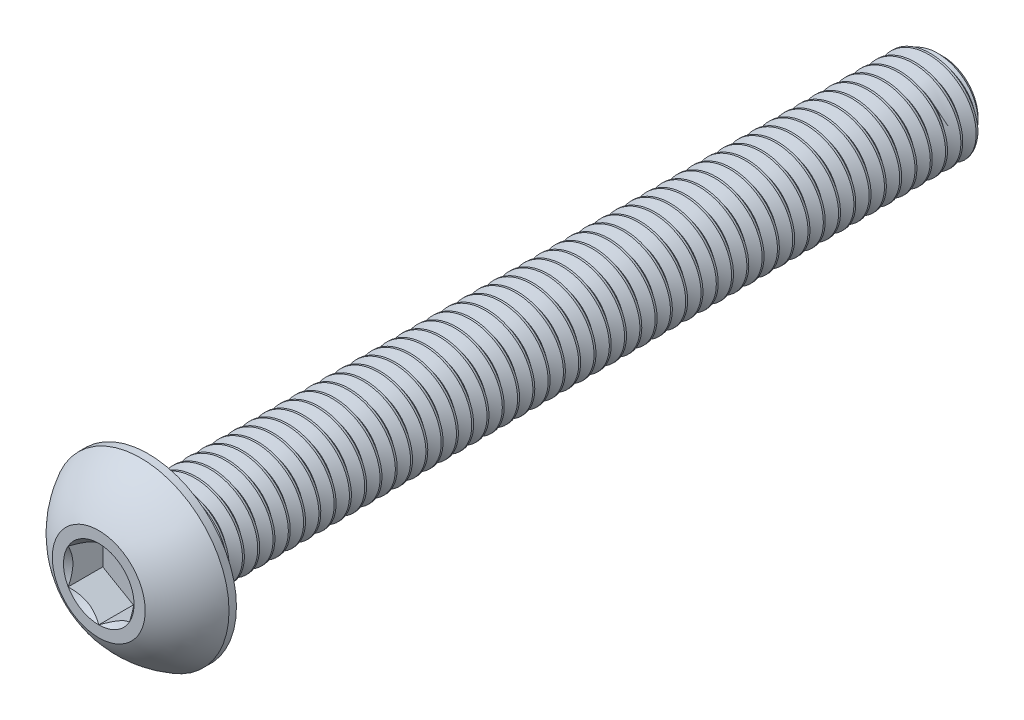
from build123d import *

# Parameters (mm, degrees)
SKETCH1_W          = 41.275
SKETCH1_H          = 2.413
CHAMFER1_SIZE      = 0.5953125
CUT_SWEEP1_PITCH   = 0.79375
CUT_EXTRUDE2_DEPTH = 1.79578
SKETCH6_R          = 1.833087105
CUT_EXTRUDE3_DEPTH = 1.79578
CUT_EXTRUDE3_TAPER = 45


with BuildPart() as part:
    # Sketch1 → Revolve1 (revolve)
    with BuildSketch(Plane(origin=(0, 0, 0), x_dir=(0, 0, -1), z_dir=(1, 0, 0))):
        with Locations((23.2029, 1.2065)):
            Rectangle(SKETCH1_W, SKETCH1_H)
    revolve(axis=Axis((0, 0, -43.8404), (0, 0, 1)))

    # Chamfer1
    chamfer1_edges = [part.edges().sort_by_distance(p)[0] for p in [
        (0, -2.413, -43.8404),
    ]]
    chamfer(chamfer1_edges, length=CHAMFER1_SIZE)

    # Cut-Sweep1: arcs per turn and ends read off the stored shape
    # Cut-Sweep1: the profile of Sketch2 profile screwed along a right-hand helix through 53 turns, 6 arcs to a turn; built about Z, then put on its axis
    cut_sweep1_z = Axis((0, 0, 0), (0, 0, 1))
    cut_sweep1_corners = [(2.4133, 0, 0.000173205), (2.4133, 0, -0.694704455), (1.897444252, 0, -0.396875), (1.897444252, 0, -0.29765625)]
    with BuildLine(mode=Mode.PRIVATE) as cut_sweep1_profile:
        Line(cut_sweep1_corners[0], cut_sweep1_corners[1])
        Line(cut_sweep1_corners[1], cut_sweep1_corners[2])
        Line(cut_sweep1_corners[2], cut_sweep1_corners[3])
        Line(cut_sweep1_corners[3], cut_sweep1_corners[0])
    cut_sweep1_cap = Face(cut_sweep1_profile.wire())
    cut_sweep1_turn_angles = [0, 30, 60, 90, 120, 150, 180, 210, 240, 270, 300, 330, 360]
    cut_sweep1_turn_weights = [1, 0.8660254037844387, 1, 0.8660254037844387, 1, 0.8660254037844387, 1, 0.8660254037844387, 1, 0.8660254037844387, 1, 0.8660254037844387, 1]
    cut_sweep1_turn_rails = [Edge.make_bspline([Vector(p[0], p[1], 0).rotate(cut_sweep1_z, cut_sweep1_turn_angles[k]) / cut_sweep1_turn_weights[k] + Vector(0, 0, p[2] + CUT_SWEEP1_PITCH * cut_sweep1_turn_angles[k] / 360) for k in range(13)], [0, 0, 0, 1, 1, 2, 2, 3, 3, 4, 4, 5, 5, 6, 6, 6], 2, cut_sweep1_turn_weights) for p in cut_sweep1_corners]
    cut_sweep1_turn_sides = [Face.make_surface_from_curves(cut_sweep1_turn_rails[p[0]], cut_sweep1_turn_rails[p[1]]) for p in [(0, 1), (1, 2), (2, 3), (3, 0)]]
    cut_sweep1 = Plane(origin=(0, 0, -43.8404), x_dir=(0, 1, 0), z_dir=(0, 0, 1)) * Solid(Shell([*[p.moved(Location((0, 0, CUT_SWEEP1_PITCH * i))) for i in range(53) for p in cut_sweep1_turn_sides], cut_sweep1_cap, cut_sweep1_cap.rotate(cut_sweep1_z, 19080).moved(Location((0, 0, CUT_SWEEP1_PITCH * 19080 / 360)))]))
    add(cut_sweep1, mode=Mode.SUBTRACT)

    # Sketch7 → Revolve2 (revolve)
    with BuildSketch(Plane(origin=(0, 0, 0), x_dir=(0, 0, -1), z_dir=(1, 0, 0)), mode=Mode.PRIVATE) as revolve2_sk:
        with BuildLine():
            Line((2.18059, 4.5847), (2.5654, 4.5847))
            Line((2.5654, 4.5847), (2.5654, 0))
            Line((2.5654, 0), (0, 0))
            Line((0, 0), (0, 2.413))
            ThreePointArc((0, 2.413), (0.925030326, 3.664791196), (2.18059, 4.5847))
        make_face()
    revolve(revolve2_sk.sketch.rotate(Axis((0, 0, 0), (0, 0, -1)), 189.336081704), axis=Axis((0, 0, 0), (0, 0, -1)))

    # Sketch5 → Cut-Extrude2 (cut)
    with BuildSketch(Plane.XY):
        Polygon((1.5875, -0.916543552), (1.5875, 0.916543552), (0, 1.833087105), (-1.5875, 0.916543552), (-1.5875, -0.916543552), (0, -1.833087105), align=None)
    extrude(amount=-CUT_EXTRUDE2_DEPTH, mode=Mode.SUBTRACT)

    # Sketch6 → Cut-Extrude3 (cut)
    with BuildSketch(Plane.XY):
        Circle(SKETCH6_R)
    extrude(amount=-CUT_EXTRUDE3_DEPTH, taper=CUT_EXTRUDE3_TAPER, mode=Mode.SUBTRACT)


solid = part.part
